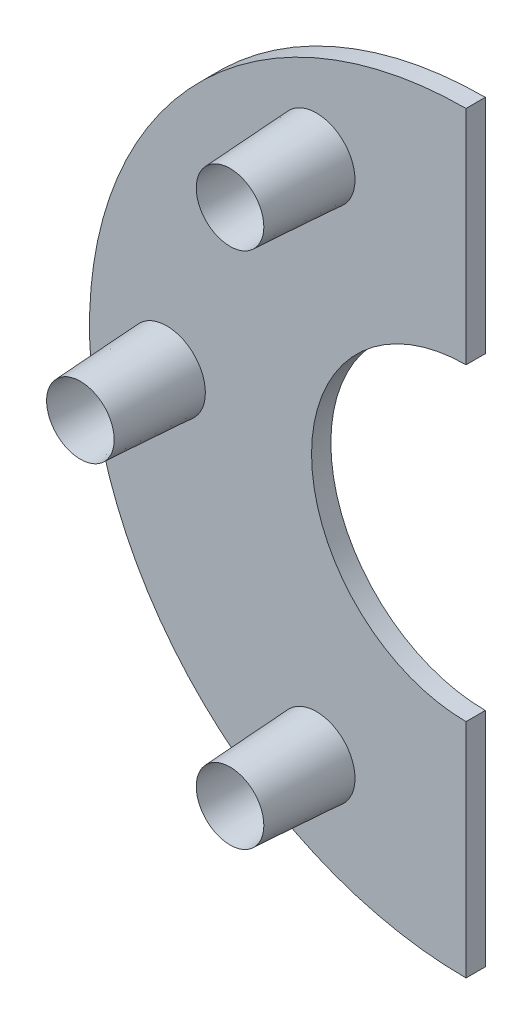
from build123d import *

# Parameters (mm, degrees)
EXTRUDE_1_DEPTH     = 0.1
SKETCH_2_R          = 0.2
SKETCH_2_R_2        = 0.15
EXTRUDE_3_DEPTH     = 0.5
EXTRUDE_3_TAPER     = 3.2
SKETCH_3_R          = 0.15
CUT_EXTRUDE_1_DEPTH = 3.793734087


with BuildPart() as part:
    # 스케치1 → 보스-돌출1 (new body)
    with BuildSketch(Plane.XY):
        with BuildLine():
            Line((0, 0.8), (0, 1.95))
            ThreePointArc((0, 1.95), (-1.95, 0), (0, -1.95))
            Line((0, -1.95), (0, -0.8))
            ThreePointArc((0, -0.8), (-0.8, 0), (0, 0.8))
        make_face()
    extrude(amount=EXTRUDE_1_DEPTH)

    # 스케치2 → 보스-돌출3 (add)
    # profile 1 of 3: a face of its own
    with BuildSketch(Plane.XY.offset(0.1)):
        with Locations((-0.775, 1.342339376)):
            Circle(SKETCH_2_R)
        with Locations((-0.775, 1.342339376)):
            Circle(SKETCH_2_R_2, mode=Mode.SUBTRACT)
    # profile 2 of 3: a face of its own
    with BuildSketch(Plane.XY.offset(0.1)):
        with Locations((-1.55, 0)):
            Circle(SKETCH_2_R)
        with Locations((-1.55, 0)):
            Circle(SKETCH_2_R_2, mode=Mode.SUBTRACT)
    # profile 3 of 3: a face of its own
    with BuildSketch(Plane.XY.offset(0.1)):
        with Locations((-0.775, -1.342339376)):
            Circle(SKETCH_2_R)
        with Locations((-0.775, -1.342339376)):
            Circle(SKETCH_2_R_2, mode=Mode.SUBTRACT)
    extrude(amount=EXTRUDE_3_DEPTH, taper=EXTRUDE_3_TAPER)

    # 스케치3 → 컷-돌출1 (cut, through all)
    with BuildSketch(Plane.XY.offset(0.1)):
        with Locations((-0.775, 1.342339376)):
            Circle(SKETCH_3_R)
        with Locations((-0.775, -1.342339376)):
            Circle(SKETCH_3_R)
        with Locations((-1.55, 0)):
            Circle(SKETCH_3_R)
    extrude(amount=-CUT_EXTRUDE_1_DEPTH, mode=Mode.SUBTRACT)


solid = part.part
